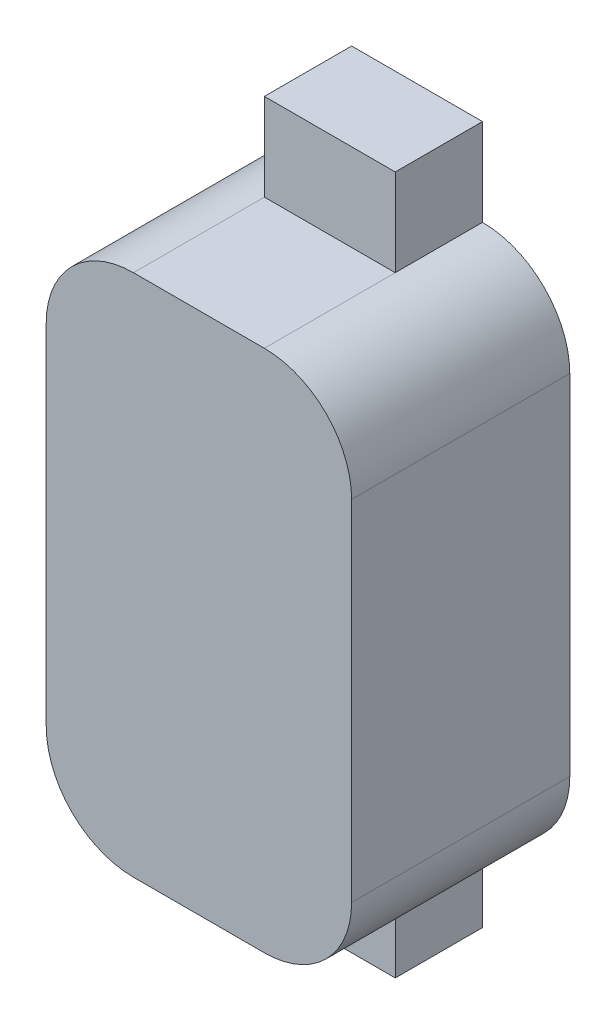
from build123d import *

# Parameters (mm, degrees)
SKETCH_1_W          = 2
SKETCH_1_H          = 4
EXTRUDE_1_DEPTH     = 2.5
SKETCH_1_3_W        = 1.5
SKETCH_1_3_H        = 1
EXTRUDE_2_DEPTH     = 1
SKETCH_1_4_W        = 2
SKETCH_1_4_H        = 4
CUT_EXTRUDE_1_DEPTH = 0.7
CHAMFER_1_SIZE      = 0.7
CHAMFER_1_SIZE_2    = 0.490145277


with BuildPart() as part:
    # 草图1 → 凸台-拉伸1 (new body)
    # profile 1 of 2: a face of its own
    with BuildSketch(Plane.XY):
        with BuildLine():
            ThreePointArc((0.75, 3), (1.457106781, 2.707106781), (1.75, 2))
            Line((1.75, 2), (1.75, -2))
            ThreePointArc((1.75, -2), (1.457106781, -2.707106781), (0.75, -3))
            Line((0.75, -3), (-0.75, -3))
            ThreePointArc((-0.75, -3), (-1.457106781, -2.707106781), (-1.75, -2))
            Line((-1.75, -2), (-1.75, 2))
            ThreePointArc((-1.75, 2), (-1.457106781, 2.707106781), (-0.75, 3))
            Line((-0.75, 3), (0.75, 3))
        make_face()
        Rectangle(SKETCH_1_W, SKETCH_1_H, mode=Mode.SUBTRACT)
    # profile 2 of 2: a face of its own
    with BuildSketch(Plane.XY):
        Rectangle(SKETCH_1_W, SKETCH_1_H)
    extrude(amount=EXTRUDE_1_DEPTH)

    # 草图1<3> → 凸台-拉伸2 (add)
    with BuildSketch(Plane.XY):
        with Locations((0, 3.5)):
            Rectangle(SKETCH_1_3_W, SKETCH_1_3_H)
        with Locations((0, -3.5)):
            Rectangle(SKETCH_1_3_W, SKETCH_1_3_H)
    extrude(amount=EXTRUDE_2_DEPTH)

    # 草图1<4> → 切除-拉伸1 (cut)
    with BuildSketch(Plane.XY):
        Rectangle(SKETCH_1_4_W, SKETCH_1_4_H)
    extrude(amount=CUT_EXTRUDE_1_DEPTH, mode=Mode.SUBTRACT)

    # 倒角1
    # the kernel refuses this chamfer: 0.7, 0.490145277 mm, written as the material it adds along each edge
    with BuildSketch(Plane(origin=(1, -2, 0.7), x_dir=(0, -0.02220967419845705, -0.99975333476413), z_dir=(-1, 0, 0)), Plane(origin=(-1, 2, 0.7), x_dir=(0, 0.02220967419845705, -0.99975333476413), z_dir=(1, 0, 0))) as chamfer_1_piece_1:
        Polygon((CHAMFER_1_SIZE * 0.999753334764, -CHAMFER_1_SIZE * 0.0222096741985), (-CHAMFER_1_SIZE_2 * 0.022209674187, -CHAMFER_1_SIZE_2 * 0.999753334248), (0, 0), align=None)
    extrude(amount=2)
    with BuildSketch(Plane(origin=(-1, -2, 0.7), x_dir=(-0.02220967419845705, 0, -0.99975333476413), z_dir=(0, 1, 0)), Plane(origin=(1, 2, 0.7), x_dir=(0.02220967419845705, 0, -0.99975333476413), z_dir=(0, -1, 0))) as chamfer_1_piece_2:
        Polygon((CHAMFER_1_SIZE * 0.999753334764, -CHAMFER_1_SIZE * 0.0222096741985), (-CHAMFER_1_SIZE_2 * 0.022209674187, -CHAMFER_1_SIZE_2 * 0.999753334248), (0, 0), align=None)
    extrude(amount=4)


solid = part.part
